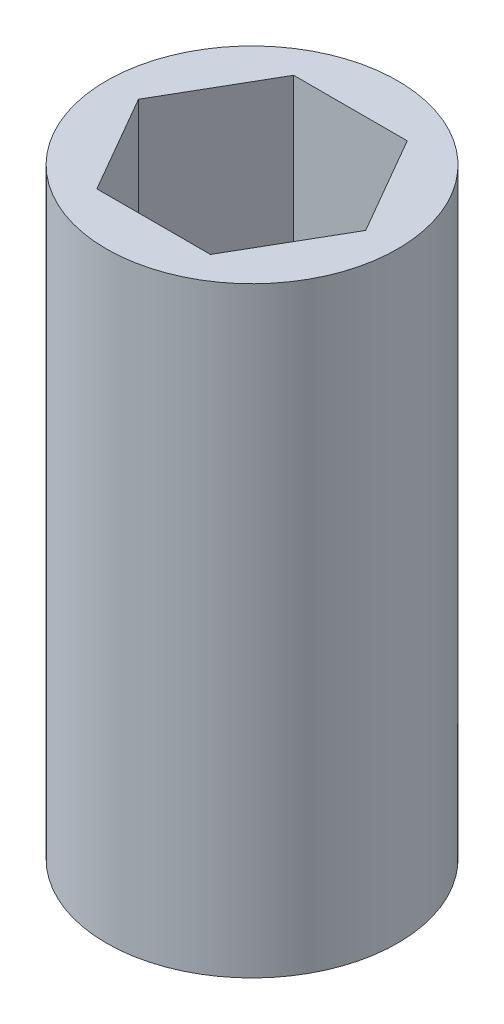
from build123d import *

# Parameters (mm, degrees)
SKETCH1_R           = 7.14375
BOSS_EXTRUDE1_DEPTH = 14.7447


with BuildPart() as part:
    # Sketch1 → Boss-Extrude1 (new, symmetric)
    with BuildSketch(Plane(origin=(0, 0, 0), x_dir=(1, 0, 0), z_dir=(0, 1, 0))):
        Circle(SKETCH1_R)
        Polygon((2.786292399, -4.826), (5.572584798, 0), (2.786292399, 4.826), (-2.786292399, 4.826), (-5.572584798, 0), (-2.786292399, -4.826), align=None, mode=Mode.SUBTRACT)
    extrude(amount=BOSS_EXTRUDE1_DEPTH, both=True)


solid = part.part
